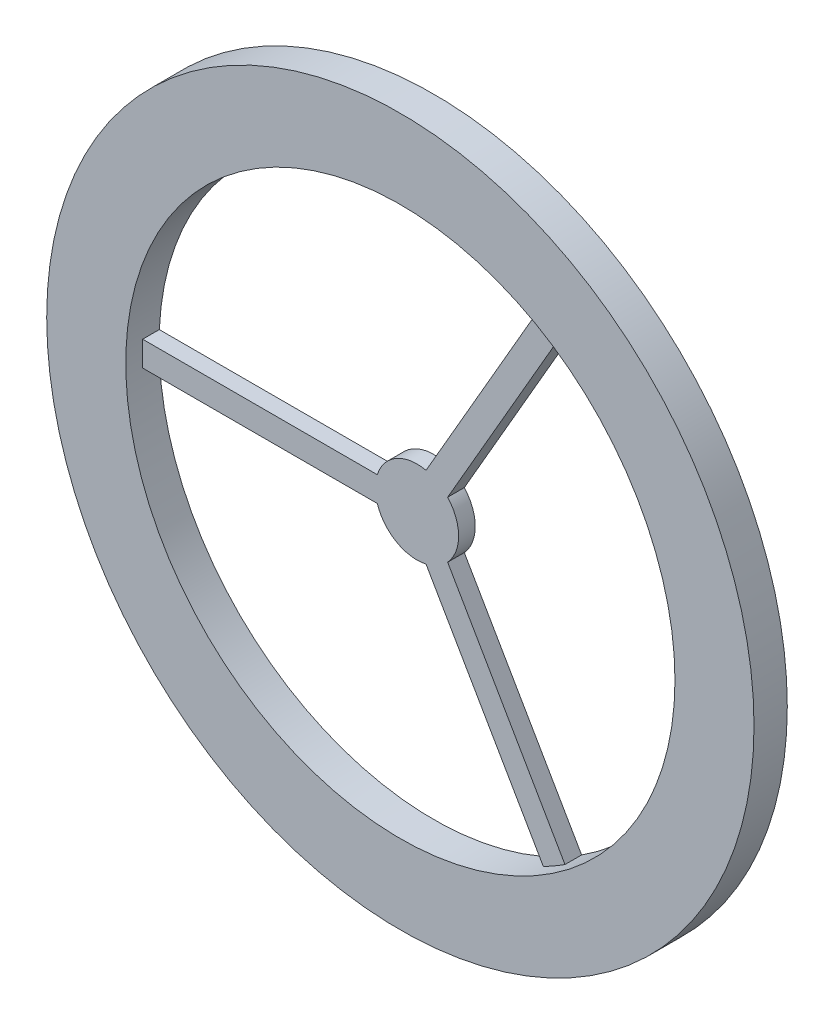
from build123d import *

# Parameters (mm, degrees)
SKETCH1_R           = 42.5
BOSS_EXTRUDE1_DEPTH = 4
SKETCH3_R           = 33
SKETCH3_R_2         = 5
CUT_EXTRUDE2_DEPTH  = 61.237031799
SKETCH4_W           = 35
SKETCH4_H           = 3
BOSS_EXTRUDE3_DEPTH = 4
SKETCH5_R           = 33
CUT_EXTRUDE4_DEPTH  = 2


# Read off the part's stored shape, not the designer's step: Cavity1
with BuildPart() as part:
    # Sketch1 → Boss-Extrude1 (new body)
    with BuildSketch(Plane.XY):
        Circle(SKETCH1_R)
    extrude(amount=BOSS_EXTRUDE1_DEPTH)

    # Cavity1 outline → Cavity1 (revolve, cut)
    with BuildSketch(Plane.XZ):
        Polygon((0.75, 0), (0.75, 3.9), (0.65, 4), (0, 4), (0, 0), align=None)
    revolve(axis=Axis((0, 0, 0), (0, 0, 1)), mode=Mode.SUBTRACT)

    # Sketch3 → Cut-Extrude2 (cut, through all)
    with BuildSketch(Plane.XY.offset(4)):
        Circle(SKETCH3_R)
        Circle(SKETCH3_R_2, mode=Mode.SUBTRACT)
    extrude(amount=-CUT_EXTRUDE2_DEPTH, mode=Mode.SUBTRACT)


with BuildPart() as cut_extrude2_piece_1:
    # of the separate pieces the step leaves, piece 1, a body of its own (cut_extrude2_pieces)
    add(part.part.solids().sort_by_distance((42.5, 0, 0))[0])



with BuildPart() as cut_extrude2_piece_2:
    # of the separate pieces the step leaves, piece 2, a body of its own (cut_extrude2_pieces)
    add(part.part.solids().sort_by_distance((5, 0, 0))[0])


with BuildPart() as cut_extrude2_piece_1_1:
    add(cut_extrude2_piece_1.part)

    add(cut_extrude2_piece_2.part)  # Boss-Extrude3 merges Cut-Extrude2 piece 2
    # Sketch4 → Boss-Extrude3 (add)
    with BuildSketch(Plane.XY.offset(4)):
        with Locations((-17.5, 0)):
            Rectangle(SKETCH4_W, SKETCH4_H)
        Polygon((-1.299038106, 0.75), (16.200961894, 31.060889132), (18.799038106, 29.560889132), (1.299038106, -0.75), align=None)
        Polygon((1.299038106, 0.75), (18.799038106, -29.560889132), (16.200961894, -31.060889132), (-1.299038106, -0.75), align=None)
    extrude(amount=-BOSS_EXTRUDE3_DEPTH)

    # Sketch5 → Cut-Extrude4 (cut)
    with BuildSketch(Plane.XY.offset(4)):
        Circle(SKETCH5_R)
    extrude(amount=-CUT_EXTRUDE4_DEPTH, mode=Mode.SUBTRACT)


solid = cut_extrude2_piece_1_1.part
